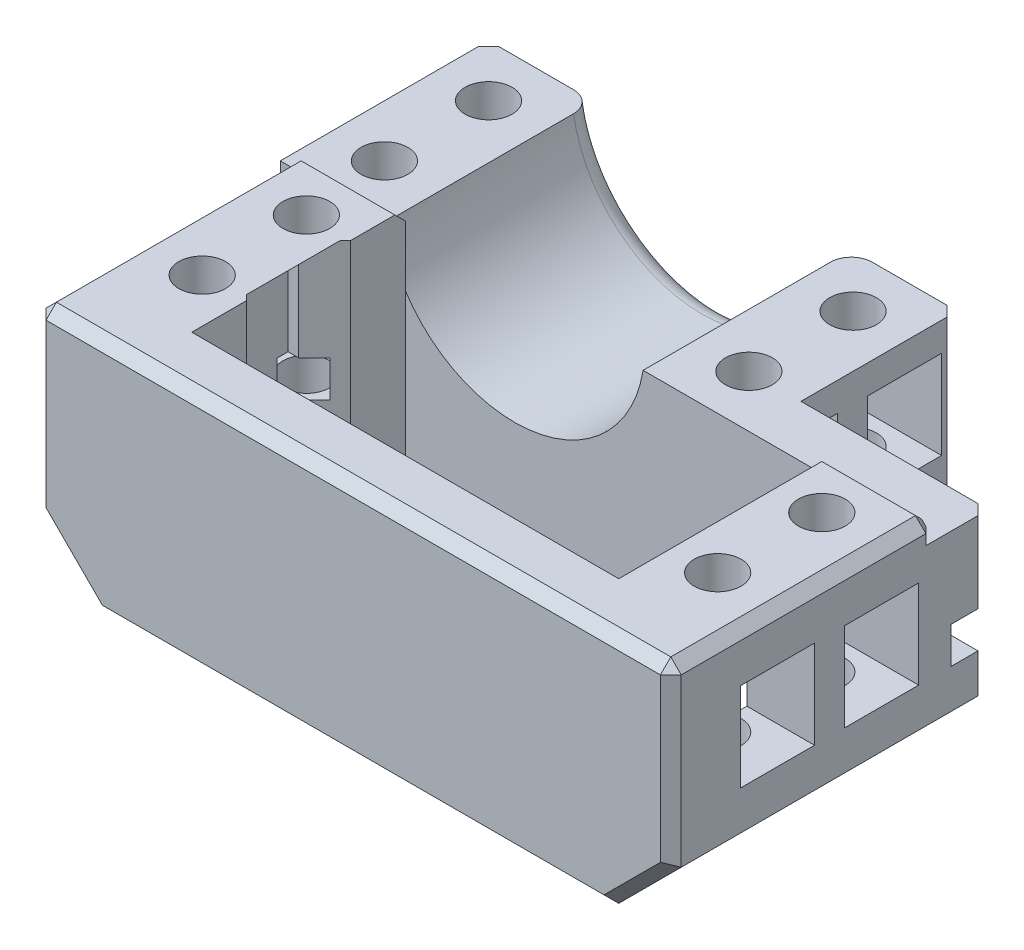
from build123d import *

# Parameters (mm, degrees)
SKETCH1_W           = 41
SKETCH1_H           = 20.5
BOSS_EXTRUDE1_DEPTH = 23
SKETCH2_R           = 12.5
CUT_EXTRUDE1_DEPTH  = 20
SKETCH3_W           = 20
SKETCH3_H           = 23
BOSS_EXTRUDE2_DEPTH = 2
CUT_EXTRUDE2_REACH  = 52.003
SKETCH4_R           = 2.25
CUT_EXTRUDE3_REACH  = 52.003
SKETCH5_R           = 2.25
CUT_EXTRUDE4_DEPTH  = 15
CUT_EXTRUDE5_START  = -9
SKETCH7_W           = 7.1
SKETCH7_H           = 3.5
CUT_EXTRUDE5_DEPTH  = 68.898747864
FILLET1_R           = 2
SKETCH8_W           = 7.1
SKETCH8_H           = 3.5
CUT_EXTRUDE6_DEPTH  = 9
CHAMFER1_SIZE       = 5
CHAMFER3_SIZE       = 5
CHAMFER4_SIZE       = 1
CHAMFER5_SIZE       = 6
CHAMFER6_SIZE       = 1
CHAMFER7_SIZE       = 1
CUT_EXTRUDE7_START  = -10
SKETCH9_W           = 63
SKETCH9_H           = 20
CUT_EXTRUDE7_DEPTH  = 2
CHAMFER8_SIZE       = 1
CUT_EXTRUDE8_REACH  = 69.32
CUT_EXTRUDE8_START  = -12
SKETCH10_W          = 3.5
SKETCH10_H          = 5
CHAMFER9_SIZE       = 2.5


with BuildPart() as part:
    # Sketch1 → Boss-Extrude1 (new body)
    with BuildSketch(Plane(origin=(0, 0, 0), x_dir=(1, 0, 0), z_dir=(0, 1, 0))):
        Polygon((0, -15.25), (-30.5, -15.25), (-30.5, 30.25), (30.5, 30.25), (30.5, -15.25), align=None)
        Rectangle(SKETCH1_W, SKETCH1_H, mode=Mode.SUBTRACT)
    extrude(amount=BOSS_EXTRUDE1_DEPTH)

    # Sketch2 → Cut-Extrude1 (cut)
    with BuildSketch(Plane(origin=(0, 0, -30.25), x_dir=(-1, 0, 0), z_dir=(0, 0, -1))):
        with Locations((10, 23)):
            Circle(SKETCH2_R)
    extrude(amount=-CUT_EXTRUDE1_DEPTH, mode=Mode.SUBTRACT)

    # Sketch3 → Boss-Extrude2 (add)
    with BuildSketch(Plane.ZY.offset(30.5)):
        with Locations((-20.25, 11.5)):
            Rectangle(SKETCH3_W, SKETCH3_H)
    extrude(amount=BOSS_EXTRUDE2_DEPTH)

    # Sketch4 → Cut-Extrude2 (cut, up to next)
    with BuildSketch(Plane(origin=(0, 23, 0), x_dir=(1, 0, 0), z_dir=(0, 1, 0)), mode=Mode.PRIVATE) as cut_extrude2_sk1:
        with Locations(Location((-27.5, 25.25, 0), (0, 0, 270))):
            Circle(SKETCH4_R)
    cut_extrude2_tool1 = extrude(cut_extrude2_sk1.sketch, amount=-CUT_EXTRUDE2_REACH, mode=Mode.PRIVATE) & part.part
    # Sketch4 → Cut-Extrude2 (cut, up to next)
    with BuildSketch(Plane(origin=(0, 23, 0), x_dir=(1, 0, 0), z_dir=(0, 1, 0)), mode=Mode.PRIVATE) as cut_extrude2_sk2:
        with Locations(Location((-27.5, 15.25, 0), (0, 0, 270))):
            Circle(SKETCH4_R)
    cut_extrude2_tool2 = extrude(cut_extrude2_sk2.sketch, amount=-CUT_EXTRUDE2_REACH, mode=Mode.PRIVATE) & part.part
    # Sketch4 → Cut-Extrude2 (cut, up to next)
    with BuildSketch(Plane(origin=(0, 23, 0), x_dir=(1, 0, 0), z_dir=(0, 1, 0)), mode=Mode.PRIVATE) as cut_extrude2_sk3:
        with Locations(Location((7.5, 15.25, 0), (0, 0, 270))):
            Circle(SKETCH4_R)
    cut_extrude2_tool3 = extrude(cut_extrude2_sk3.sketch, amount=-CUT_EXTRUDE2_REACH, mode=Mode.PRIVATE) & part.part
    # Sketch4 → Cut-Extrude2 (cut, up to next)
    with BuildSketch(Plane(origin=(0, 23, 0), x_dir=(1, 0, 0), z_dir=(0, 1, 0)), mode=Mode.PRIVATE) as cut_extrude2_sk4:
        with Locations(Location((7.5, 25.25, 0), (0, 0, 270))):
            Circle(SKETCH4_R)
    cut_extrude2_tool4 = extrude(cut_extrude2_sk4.sketch, amount=-CUT_EXTRUDE2_REACH, mode=Mode.PRIVATE) & part.part
    add(cut_extrude2_tool1.solids().sort_by_distance((-27.5, 23, -25.25))[0], mode=Mode.SUBTRACT)
    add(cut_extrude2_tool2.solids().sort_by_distance((-27.5, 23, -15.25))[0], mode=Mode.SUBTRACT)
    add(cut_extrude2_tool3.solids().sort_by_distance((7.5, 23, -15.25))[0], mode=Mode.SUBTRACT)
    add(cut_extrude2_tool4.solids().sort_by_distance((7.5, 23, -25.25))[0], mode=Mode.SUBTRACT)

    # Sketch5 → Cut-Extrude3 (cut, up to next)
    with BuildSketch(Plane(origin=(0, 23, 0), x_dir=(1, 0, 0), z_dir=(0, 1, 0)), mode=Mode.PRIVATE) as cut_extrude3_sk1:
        with Locations(Location((-24.75, 5, 0), (0, 0, 270))):
            Circle(SKETCH5_R)
    cut_extrude3_tool1 = extrude(cut_extrude3_sk1.sketch, amount=-CUT_EXTRUDE3_REACH, mode=Mode.PRIVATE) & part.part
    # Sketch5 → Cut-Extrude3 (cut, up to next)
    with BuildSketch(Plane(origin=(0, 23, 0), x_dir=(1, 0, 0), z_dir=(0, 1, 0)), mode=Mode.PRIVATE) as cut_extrude3_sk2:
        with Locations(Location((-24.75, -5, 0), (0, 0, 270))):
            Circle(SKETCH5_R)
    cut_extrude3_tool2 = extrude(cut_extrude3_sk2.sketch, amount=-CUT_EXTRUDE3_REACH, mode=Mode.PRIVATE) & part.part
    cut_extrude3_1 = cut_extrude3_tool1.solids().sort_by_distance((-24.75, 23, -5))[0]
    add(cut_extrude3_1, mode=Mode.SUBTRACT)
    cut_extrude3_2 = cut_extrude3_tool2.solids().sort_by_distance((-24.75, 23, 5))[0]
    add(cut_extrude3_2, mode=Mode.SUBTRACT)
    cut_extrude3 = cut_extrude3_1 + cut_extrude3_2  # Cut-Extrude3 as one shape, for the pattern or mirror that repeats it

    # Mirror1: Cut-Extrude3 across plane
    add(cut_extrude3.mirror(Plane(origin=(0, 0, 0), x_dir=(0, 0, 1), z_dir=(1, 0, 0))), mode=Mode.SUBTRACT)

    # Sketch6 → Cut-Extrude4 (cut)
    with BuildSketch(Plane(origin=(0, 0, -30.25), x_dir=(-1, 0, 0), z_dir=(0, 0, -1))):
        Polygon((-12.5, 23), (-12.5, 19), (-12.5, 4), (-12.5, 0), (-30.5, 0), (-30.5, 4), (-30.5, 19), (-30.5, 23), align=None)
    extrude(amount=-CUT_EXTRUDE4_DEPTH, mode=Mode.SUBTRACT)

    # Sketch7 → Cut-Extrude5 (cut)
    with BuildSketch(Plane(origin=(12.5, 0, 0), x_dir=(0, 0, -1), z_dir=(1, 0, 0)).offset(CUT_EXTRUDE5_START)):
        with Locations((25.2, 11.5)):
            Rectangle(SKETCH7_W, SKETCH7_H)
        with Locations((15.2, 11.5)):
            Rectangle(SKETCH7_W, SKETCH7_H)
    cut_extrude5 = extrude(amount=CUT_EXTRUDE5_DEPTH, mode=Mode.SUBTRACT)

    # Mirror2: Cut-Extrude5 across plane
    add(cut_extrude5.mirror(Plane(origin=(-10, 0, 0), x_dir=(0, 0, 1), z_dir=(1, 0, 0))), mode=Mode.SUBTRACT)

    # Fillet1
    fillet1_edges = [part.edges().sort_by_distance(p)[0] for p in [
        (-10, 10.5, -30.25),
    ]]
    fillet(fillet1_edges, radius=FILLET1_R)

    # Sketch8 → Cut-Extrude6 (cut)
    with BuildSketch(Plane.ZY.offset(30.5)):
        with Locations((-5, 11.5)):
            Rectangle(SKETCH8_W, SKETCH8_H)
        with Locations((5, 11.5)):
            Rectangle(SKETCH8_W, SKETCH8_H)
    cut_extrude6 = extrude(amount=-CUT_EXTRUDE6_DEPTH, mode=Mode.SUBTRACT)

    # Mirror3: Cut-Extrude6 across plane
    add(cut_extrude6.mirror(Plane(origin=(0, 0, 0), x_dir=(0, 0, 1), z_dir=(1, 0, 0))), mode=Mode.SUBTRACT)

    # Chamfer1
    # the kernel refuses this chamfer: 5 mm, written as the material it takes off along each edge
    with BuildSketch(Plane(origin=(12.5, 13.25, -8.79158506), x_dir=(0.027495876610586317, 0.9996219169112968, 0), z_dir=(0, 0, -1))) as chamfer1_piece_1_section:
        Polygon((CHAMFER1_SIZE * 0.999621916911, -CHAMFER1_SIZE * 0.0274958766106), (-CHAMFER1_SIZE * 0.0274958766106, -CHAMFER1_SIZE * 0.999621916911), (0, 0), align=None)
    chamfer1_piece_1 = extrude(amount=32.81682988, mode=Mode.PRIVATE)
    chamfer1_piece_1 = split(chamfer1_piece_1, bisect_by=Plane(origin=(11.024157606, 15.012078803, -15.25), z_dir=(0, 0, -1)), keep=Keep.TOP, mode=Mode.PRIVATE)
    chamfer1_piece_1 = split(chamfer1_piece_1, bisect_by=Plane(origin=(11.024157606, 15.012078803, -18.75), z_dir=(0, 0, 1)), keep=Keep.TOP, mode=Mode.PRIVATE)
    add(chamfer1_piece_1, mode=Mode.SUBTRACT)
    with BuildSketch(Plane(origin=(12.5, 13.25, -21.65), x_dir=(0.027495876610586317, 0.9996219169112968, 0), z_dir=(0, 0, -1)), Plane(origin=(-32.5, 13.25, -28.75), x_dir=(-0.02749587661058631, 0.9996219169112968, 0), z_dir=(0, 0, 1)), Plane(origin=(-32.5, 13.25, -18.75), x_dir=(-0.027495876610586317, 0.9996219169112968, 0), z_dir=(0, 0, 1)), Plane(origin=(-30.5, 13.25, 1.45), x_dir=(-0.027495876610586317, 0.9996219169112968, 0), z_dir=(0, 0, 1)), Plane(origin=(30.5, 13.25, -1.45), x_dir=(0.027495876610586317, 0.9996219169112968, 0), z_dir=(0, 0, -1))) as chamfer1_piece_2:
        Polygon((CHAMFER1_SIZE * 0.999621916911, -CHAMFER1_SIZE * 0.0274958766106), (-CHAMFER1_SIZE * 0.0274958766106, -CHAMFER1_SIZE * 0.999621916911), (0, 0), align=None)
    extrude(amount=7.1, mode=Mode.SUBTRACT)
    with BuildSketch(Plane(origin=(12.5, 13.25, -15.25), x_dir=(0.02749587661058631, 0.9996219169112968, 0), z_dir=(0, 0, -1))) as chamfer1_piece_3:
        Polygon((CHAMFER1_SIZE * 0.999621916911, -CHAMFER1_SIZE * 0.0274958766106), (-CHAMFER1_SIZE * 0.0274958766106, -CHAMFER1_SIZE * 0.999621916911), (0, 0), align=None)
    extrude(amount=3.5, mode=Mode.SUBTRACT)
    with BuildSketch(Plane(origin=(12.5, 13.25, -2.39158506), x_dir=(0.02749587661058631, 0.9996219169112968, 0), z_dir=(0, 0, -1))) as chamfer1_piece_4_section:
        Polygon((CHAMFER1_SIZE * 0.999621916911, -CHAMFER1_SIZE * 0.0274958766106), (-CHAMFER1_SIZE * 0.0274958766106, -CHAMFER1_SIZE * 0.999621916911), (0, 0), align=None)
    chamfer1_piece_4 = extrude(amount=29.21682988, mode=Mode.PRIVATE)
    chamfer1_piece_4 = split(chamfer1_piece_4, bisect_by=Plane(origin=(11.021218457, 15.010609228, -21.65), z_dir=(0, 0, -1)), keep=Keep.TOP, mode=Mode.PRIVATE)
    chamfer1_piece_4 = split(chamfer1_piece_4, bisect_by=Plane(origin=(11.021218457, 15.010609228, -28.75), z_dir=(0, 0, 1)), keep=Keep.TOP, mode=Mode.PRIVATE)
    add(chamfer1_piece_4, mode=Mode.SUBTRACT)
    with BuildSketch(Plane(origin=(-32.5, 13.25, -41.60841494), x_dir=(-0.027495876610586327, 0.9996219169112968, 0), z_dir=(0, 0, 1))) as chamfer1_piece_5_section:
        Polygon((CHAMFER1_SIZE * 0.999621916911, -CHAMFER1_SIZE * 0.0274958766106), (-CHAMFER1_SIZE * 0.0274958766106, -CHAMFER1_SIZE * 0.999621916911), (0, 0), align=None)
    chamfer1_piece_5 = extrude(amount=32.81682988, mode=Mode.PRIVATE)
    chamfer1_piece_5 = split(chamfer1_piece_5, bisect_by=Plane(origin=(-31.583333333, 15.291666667, -11.65), z_dir=(0, 0, -1)), keep=Keep.TOP, mode=Mode.PRIVATE)
    chamfer1_piece_5 = split(chamfer1_piece_5, bisect_by=Plane(origin=(-31.583333333, 15.291666667, -18.75), z_dir=(0, 0, 1)), keep=Keep.TOP, mode=Mode.PRIVATE)
    add(chamfer1_piece_5, mode=Mode.SUBTRACT)
    with BuildSketch(Plane(origin=(-32.5, 13.25, -31.60841494), x_dir=(-0.027495876610586317, 0.9996219169112968, 0), z_dir=(0, 0, 1))) as chamfer1_piece_6_section:
        Polygon((CHAMFER1_SIZE * 0.999621916911, -CHAMFER1_SIZE * 0.0274958766106), (-CHAMFER1_SIZE * 0.0274958766106, -CHAMFER1_SIZE * 0.999621916911), (0, 0), align=None)
    chamfer1_piece_6 = extrude(amount=32.81682988, mode=Mode.PRIVATE)
    chamfer1_piece_6 = split(chamfer1_piece_6, bisect_by=Plane(origin=(-31.583333333, 15.291666667, -21.65), z_dir=(0, 0, -1)), keep=Keep.TOP, mode=Mode.PRIVATE)
    chamfer1_piece_6 = split(chamfer1_piece_6, bisect_by=Plane(origin=(-31.583333333, 15.291666667, -28.75), z_dir=(0, 0, 1)), keep=Keep.TOP, mode=Mode.PRIVATE)
    add(chamfer1_piece_6, mode=Mode.SUBTRACT)
    with BuildSketch(Plane(origin=(-32.5, 13.25, -31.60841494), x_dir=(-0.027495876610586317, 0.9996219169112968, 0), z_dir=(0, 0, 1))) as chamfer1_piece_7_section:
        Polygon((CHAMFER1_SIZE * 0.999621916911, -CHAMFER1_SIZE * 0.0274958766106), (-CHAMFER1_SIZE * 0.0274958766106, -CHAMFER1_SIZE * 0.999621916911), (0, 0), align=None)
    chamfer1_piece_7 = extrude(amount=32.81682988, mode=Mode.PRIVATE)
    chamfer1_piece_7 = split(chamfer1_piece_7, bisect_by=Plane(origin=(-29.5, 14.25, -1.45), z_dir=(0, 0, -1)), keep=Keep.TOP, mode=Mode.PRIVATE)
    chamfer1_piece_7 = split(chamfer1_piece_7, bisect_by=Plane(origin=(-29.5, 14.25, -8.55), z_dir=(0, 0, 1)), keep=Keep.TOP, mode=Mode.PRIVATE)
    add(chamfer1_piece_7, mode=Mode.SUBTRACT)
    with BuildSketch(Plane(origin=(-30.5, 13.25, -11.40841494), x_dir=(-0.027495876610586317, 0.9996219169112968, 0), z_dir=(0, 0, 1))) as chamfer1_piece_8_section:
        Polygon((CHAMFER1_SIZE * 0.999621916911, -CHAMFER1_SIZE * 0.0274958766106), (-CHAMFER1_SIZE * 0.0274958766106, -CHAMFER1_SIZE * 0.999621916911), (0, 0), align=None)
    chamfer1_piece_8 = extrude(amount=32.81682988, mode=Mode.PRIVATE)
    chamfer1_piece_8 = split(chamfer1_piece_8, bisect_by=Plane(origin=(-28.915946442, 14.957973221, -1.45), z_dir=(0, 0, -1)), keep=Keep.TOP, mode=Mode.PRIVATE)
    chamfer1_piece_8 = split(chamfer1_piece_8, bisect_by=Plane(origin=(-28.915946442, 14.957973221, -8.55), z_dir=(0, 0, 1)), keep=Keep.TOP, mode=Mode.PRIVATE)
    add(chamfer1_piece_8, mode=Mode.SUBTRACT)
    with BuildSketch(Plane(origin=(-30.5, 13.25, 11.40841494), x_dir=(-0.027495876610586327, 0.9996219169112968, 0), z_dir=(0, 0, -1))) as chamfer1_piece_9_section:
        Polygon((CHAMFER1_SIZE * 0.999621916911, CHAMFER1_SIZE * 0.0274958766106), (-CHAMFER1_SIZE * 0.0274958766106, CHAMFER1_SIZE * 0.999621916911), (0, 0), align=None)
    chamfer1_piece_9 = extrude(amount=32.81682988, mode=Mode.PRIVATE)
    chamfer1_piece_9 = split(chamfer1_piece_9, bisect_by=Plane(origin=(-28.915946442, 14.957973221, 8.55), z_dir=(0, 0, -1)), keep=Keep.TOP, mode=Mode.PRIVATE)
    chamfer1_piece_9 = split(chamfer1_piece_9, bisect_by=Plane(origin=(-28.915946442, 14.957973221, 1.45), z_dir=(0, 0, 1)), keep=Keep.TOP, mode=Mode.PRIVATE)
    add(chamfer1_piece_9, mode=Mode.SUBTRACT)
    with BuildSketch(Plane(origin=(-30.5, 13.25, -1.45), x_dir=(-0.027495876610586317, 0.9996219169112968, 0), z_dir=(0, 0, -1)), Plane(origin=(30.5, 13.25, 1.45), x_dir=(0.027495876610586317, 0.9996219169112968, 0), z_dir=(0, 0, 1))) as chamfer1_piece_10:
        Polygon((CHAMFER1_SIZE * 0.999621916911, CHAMFER1_SIZE * 0.0274958766106), (-CHAMFER1_SIZE * 0.0274958766106, CHAMFER1_SIZE * 0.999621916911), (0, 0), align=None)
    extrude(amount=7.1, mode=Mode.SUBTRACT)
    with BuildSketch(Plane(origin=(30.5, 13.25, -11.40841494), x_dir=(0.027495876610586317, 0.9996219169112968, 0), z_dir=(0, 0, 1))) as chamfer1_piece_11_section:
        Polygon((CHAMFER1_SIZE * 0.999621916911, CHAMFER1_SIZE * 0.0274958766106), (-CHAMFER1_SIZE * 0.0274958766106, CHAMFER1_SIZE * 0.999621916911), (0, 0), align=None)
    chamfer1_piece_11 = extrude(amount=32.81682988, mode=Mode.PRIVATE)
    chamfer1_piece_11 = split(chamfer1_piece_11, bisect_by=Plane(origin=(28.915946442, 14.957973221, -8.55), z_dir=(0, 0, 1)), keep=Keep.TOP, mode=Mode.PRIVATE)
    chamfer1_piece_11 = split(chamfer1_piece_11, bisect_by=Plane(origin=(28.915946442, 14.957973221, -1.45), z_dir=(0, 0, -1)), keep=Keep.TOP, mode=Mode.PRIVATE)
    add(chamfer1_piece_11, mode=Mode.SUBTRACT)
    with BuildSketch(Plane(origin=(30.5, 13.25, 11.40841494), x_dir=(0.027495876610586327, 0.9996219169112968, 0), z_dir=(0, 0, -1))) as chamfer1_piece_12_section:
        Polygon((CHAMFER1_SIZE * 0.999621916911, -CHAMFER1_SIZE * 0.0274958766106), (-CHAMFER1_SIZE * 0.0274958766106, -CHAMFER1_SIZE * 0.999621916911), (0, 0), align=None)
    chamfer1_piece_12 = extrude(amount=32.81682988, mode=Mode.PRIVATE)
    chamfer1_piece_12 = split(chamfer1_piece_12, bisect_by=Plane(origin=(28.915946442, 14.957973221, 1.45), z_dir=(0, 0, 1)), keep=Keep.TOP, mode=Mode.PRIVATE)
    chamfer1_piece_12 = split(chamfer1_piece_12, bisect_by=Plane(origin=(28.915946442, 14.957973221, 8.55), z_dir=(0, 0, -1)), keep=Keep.TOP, mode=Mode.PRIVATE)
    add(chamfer1_piece_12, mode=Mode.SUBTRACT)

    # Chamfer2
    # the kernel refuses this chamfer: 8 mm, written as the material it takes off along each edge
    with BuildSketch(Plane(origin=(-32.5, 0, 39.126313369), x_dir=(0.9996219169112968, -0.027495876610586365, 0), z_dir=(0, 0, -1))) as chamfer2_piece_1:
        with BuildLine():
            Line((8.229385561, 0), (-0.452377239, -8.216942348))
            Line((-0.452377239, -8.216942348), (-0.612316746, -8.212543008))
            ThreePointArc((-0.612316746, -8.212543008), (-0.273033816, -4.107182637), (-0.159939507, 0.00439934))
            Line((-0.159939507, 0.00439934), (0.00439934, 0.159939507))
            ThreePointArc((0.00439934, 0.159939507), (4.115981318, 0.046845197), (8.233784902, 0.159939507))
            Line((8.233784902, 0.159939507), (8.229385561, 0))
        make_face()
    extrude(amount=118.752626738, mode=Mode.SUBTRACT)

    # Chamfer3
    # the kernel refuses this chamfer: 5 mm, written as the material it takes off along each edge
    with BuildSketch(Plane(origin=(12.5, 0, -43.10841494), x_dir=(0.027495876610586317, 0.9996219169112968, 0), z_dir=(0, 0, 1))) as chamfer3_piece_1:
        Polygon((CHAMFER3_SIZE * 0.999621916911, CHAMFER3_SIZE * 0.0274958766106), (-CHAMFER3_SIZE * 0.0274958766106, CHAMFER3_SIZE * 0.999621916911), (0, 0), align=None)
    extrude(amount=27.85841494, mode=Mode.SUBTRACT)

    # Chamfer4
    chamfer4_edges = [part.edges().sort_by_distance(p)[0] for p in [
        (-28.5, 4, -30.25),
        (12.5, 14, -30.25),
        (-8.5, 0, -30.25),
        (10, 2.5, -30.25),
        (-32.5, 15.5, -30.25),
    ]]
    chamfer(chamfer4_edges, length=CHAMFER4_SIZE)

    # Chamfer5
    # the kernel refuses this chamfer: 6 mm, written as the material it takes off along each edge
    with BuildSketch(Plane(origin=(30.5, 0, -30.680097928), x_dir=(0.027495876610586202, 0.9996219169112968, 0), z_dir=(0, 0, 1))) as chamfer5_piece_1:
        Polygon((CHAMFER5_SIZE * 0.999621916911, CHAMFER5_SIZE * 0.0274958766106), (-CHAMFER5_SIZE * 0.0274958766106, CHAMFER5_SIZE * 0.999621916911), (0, 0), align=None)
    extrude(amount=61.360195856, mode=Mode.SUBTRACT)

    # Chamfer6
    chamfer6_edges = [part.edges().sort_by_distance(p)[0] for p in [
        (21.5, 23, -15.25),
        (30.5, 18.125, -15.25),
        (30.5, 7.875, -15.25),
        (21.5, 9.75, -15.25),
        (20.125, 13.25, -15.25),
        (0, 0, 15.25),
        (-27.5, 3, 15.25),
        (27.5, 3, 15.25),
        (-30.5, 23, 2.5),
        (0, 23, 15.25),
        (30.5, 23, 0),
        (-30.5, 14.5, 15.25),
        (30.5, 14.5, 15.25),
    ]]
    chamfer(chamfer6_edges, length=CHAMFER6_SIZE)

    # Chamfer7
    chamfer7_edges = [part.edges().sort_by_distance(p)[0] for p in [
        (17.125, 0, -15.25),
        (27, 2.5, -15.25),
    ]]
    chamfer(chamfer7_edges, length=CHAMFER7_SIZE)

    # Sketch9 → Cut-Extrude7 (cut)
    with BuildSketch(Plane(origin=(0, 33, 0), x_dir=(1, 0, 0), z_dir=(0, 1, 0)).offset(CUT_EXTRUDE7_START)):
        with Locations((-1, 20.25)):
            Rectangle(SKETCH9_W, SKETCH9_H)
    extrude(amount=-CUT_EXTRUDE7_DEPTH, mode=Mode.SUBTRACT)

    # Chamfer8
    chamfer8_edges = [part.edges().sort_by_distance(p)[0] for p in [
        (-25, 23, -10.25),
        (-30, 22.5, -10.25),
        (25, 23, -10.25),
        (30.5, 21.5, -10.25),
        (30, 22.5, -10.25),
        (-30.5, 21.5, -10.25),
    ]]
    chamfer(chamfer8_edges, length=CHAMFER8_SIZE)

    # Sketch10 → Cut-Extrude8 (cut, up to next)
    with BuildSketch(Plane(origin=(0, 33, 0), x_dir=(1, 0, 0), z_dir=(0, 1, 0)).offset(CUT_EXTRUDE8_START), mode=Mode.PRIVATE) as cut_extrude8_sk1:
        with Locations((22.25, 0)):
            Rectangle(SKETCH10_W, SKETCH10_H)
    cut_extrude8_tool1 = extrude(cut_extrude8_sk1.sketch, amount=-CUT_EXTRUDE8_REACH, mode=Mode.PRIVATE) & part.part
    cut_extrude8 = cut_extrude8_tool1.solids().sort_by_distance((22.25, 21, 0))[0]
    add(cut_extrude8, mode=Mode.SUBTRACT)

    # Chamfer9
    # the kernel refuses this chamfer: 2.5 mm, written as the material it takes off along each edge
    with BuildSketch(Plane(origin=(20.5, 21, -2.5), x_dir=(-0.027495876610586317, 0, -0.9996219169112968), z_dir=(0, -1, 0))) as chamfer9_piece_1:
        Polygon((CHAMFER9_SIZE * 0.999621916911, CHAMFER9_SIZE * 0.0274958766106), (-CHAMFER9_SIZE * 0.0274958766106, CHAMFER9_SIZE * 0.999621916911), (0, 0), align=None)
    extrude(amount=27.42920747, mode=Mode.SUBTRACT)
    with BuildSketch(Plane(origin=(20.5, 21, 2.5), x_dir=(-0.027495876610586317, 0, 0.9996219169112968), z_dir=(0, -1, 0))) as chamfer9_piece_2:
        Polygon((CHAMFER9_SIZE * 0.999621916911, -CHAMFER9_SIZE * 0.0274958766106), (-CHAMFER9_SIZE * 0.0274958766106, -CHAMFER9_SIZE * 0.999621916911), (0, 0), align=None)
    extrude(amount=27.42920747, mode=Mode.SUBTRACT)

    # Mirror4: Cut-Extrude8 across plane
    add(cut_extrude8.mirror(Plane(origin=(0, 0, 0), x_dir=(0, 0, 1), z_dir=(1, 0, 0))), mode=Mode.SUBTRACT)

    # Chamfer10
    # the kernel refuses this chamfer: 2.5 mm, written as the material it takes off along each edge
    with BuildSketch(Plane(origin=(-20.5, 21, 2.5), x_dir=(0.027495876610586317, 0, 0.9996219169112968), z_dir=(0, -1, 0))) as chamfer10_piece_1:
        with BuildLine():
            Line((2.571682988, 0), (-0.141367887, 2.567794484))
            Line((-0.141367887, 2.567794484), (-0.191348983, 2.56641969))
            ThreePointArc((-0.191348983, 2.56641969), (-0.085323068, 1.283494574), (-0.049981096, -0.001374794))
            Line((-0.049981096, -0.001374794), (0.001374794, -0.049981096))
            ThreePointArc((0.001374794, -0.049981096), (1.286244162, -0.014639124), (2.573057782, -0.049981096))
            Line((2.573057782, -0.049981096), (2.571682988, 0))
        make_face()
    extrude(amount=21, mode=Mode.SUBTRACT)
    with BuildSketch(Plane(origin=(-20.5, 21, 2.5), x_dir=(0.027495876610586317, 0.9996219169112968, 0), z_dir=(0, 0, -1))) as chamfer10_piece_2:
        with BuildLine():
            Line((2.571682988, 0), (-0.141367887, -2.567794484))
            Line((-0.141367887, -2.567794484), (-0.191348983, -2.56641969))
            ThreePointArc((-0.191348983, -2.56641969), (-0.085323068, -1.283494574), (-0.049981096, 0.001374794))
            Line((-0.049981096, 0.001374794), (0.001374794, 0.049981096))
            ThreePointArc((0.001374794, 0.049981096), (1.286244162, 0.014639124), (2.573057782, 0.049981096))
            Line((2.573057782, 0.049981096), (2.571682988, 0))
        make_face()
    extrude(amount=5, mode=Mode.SUBTRACT)
    with BuildSketch(Plane(origin=(-20.5, 21, -2.5), x_dir=(0.027495876610586317, 0, -0.9996219169112968), z_dir=(0, -1, 0))) as chamfer10_piece_3:
        with BuildLine():
            Line((2.571682988, 0), (-0.141367887, -2.567794484))
            Line((-0.141367887, -2.567794484), (-0.191348983, -2.56641969))
            ThreePointArc((-0.191348983, -2.56641969), (-0.085323068, -1.283494574), (-0.049981096, 0.001374794))
            Line((-0.049981096, 0.001374794), (0.001374794, 0.049981096))
            ThreePointArc((0.001374794, 0.049981096), (1.286244162, 0.014639124), (2.573057782, 0.049981096))
            Line((2.573057782, 0.049981096), (2.571682988, 0))
        make_face()
    extrude(amount=21, mode=Mode.SUBTRACT)
    with BuildSketch(Plane(origin=(-20.5, 27.42920747, 2.5), x_dir=(0.027495876610586317, 0, 0.9996219169112968), z_dir=(0, -1, 0))) as chamfer10_piece_4a_section:
        with BuildLine():
            Line((2.571682988, 0), (-0.141367887, 2.567794484))
            Line((-0.141367887, 2.567794484), (-0.191348983, 2.56641969))
            ThreePointArc((-0.191348983, 2.56641969), (-0.085323068, 1.283494574), (-0.049981096, -0.001374794))
            Line((-0.049981096, -0.001374794), (0.001374794, -0.049981096))
            ThreePointArc((0.001374794, -0.049981096), (1.286244162, -0.014639124), (2.573057782, -0.049981096))
            Line((2.573057782, -0.049981096), (2.571682988, 0))
        make_face()
    chamfer10_piece_4a = extrude(amount=27.42920747, mode=Mode.PRIVATE)
    chamfer10_piece_4a = split(chamfer10_piece_4a, bisect_by=Plane(origin=(-21.324484067, 21, 3.324484067), z_dir=(0, 1, 0)), keep=Keep.TOP, mode=Mode.PRIVATE)
    with BuildSketch(Plane(origin=(-20.5, 21, 8.92920747), x_dir=(0.027495876610586317, 0.9996219169112968, 0), z_dir=(0, 0, -1))) as chamfer10_piece_4b_section:
        with BuildLine():
            Line((2.571682988, 0), (-0.141367887, -2.567794484))
            Line((-0.141367887, -2.567794484), (-0.191348983, -2.56641969))
            ThreePointArc((-0.191348983, -2.56641969), (-0.085323068, -1.283494574), (-0.049981096, 0.001374794))
            Line((-0.049981096, 0.001374794), (0.001374794, 0.049981096))
            ThreePointArc((0.001374794, 0.049981096), (1.286244162, 0.014639124), (2.573057782, 0.049981096))
            Line((2.573057782, 0.049981096), (2.571682988, 0))
        make_face()
    chamfer10_piece_4b = extrude(amount=11.42920747, mode=Mode.PRIVATE)
    chamfer10_piece_4b = split(chamfer10_piece_4b, bisect_by=Plane(origin=(-21.324484067, 21.824484067, 2.5), z_dir=(0, 0, 1)), keep=Keep.TOP, mode=Mode.PRIVATE)
    chamfer10_piece_4 = chamfer10_piece_4a & chamfer10_piece_4b
    add(chamfer10_piece_4, mode=Mode.SUBTRACT)
    with BuildSketch(Plane(origin=(-20.5, 21, 2.5), x_dir=(0.027495876610586317, 0.9996219169112968, 0), z_dir=(0, 0, -1))) as chamfer10_piece_5a_section:
        with BuildLine():
            Line((2.571682988, 0), (-0.141367887, -2.567794484))
            Line((-0.141367887, -2.567794484), (-0.191348983, -2.56641969))
            ThreePointArc((-0.191348983, -2.56641969), (-0.085323068, -1.283494574), (-0.049981096, 0.001374794))
            Line((-0.049981096, 0.001374794), (0.001374794, 0.049981096))
            ThreePointArc((0.001374794, 0.049981096), (1.286244162, 0.014639124), (2.573057782, 0.049981096))
            Line((2.573057782, 0.049981096), (2.571682988, 0))
        make_face()
    chamfer10_piece_5a = extrude(amount=11.42920747, mode=Mode.PRIVATE)
    chamfer10_piece_5a = split(chamfer10_piece_5a, bisect_by=Plane(origin=(-21.324484067, 21.824484067, -2.5), z_dir=(0, 0, -1)), keep=Keep.TOP, mode=Mode.PRIVATE)
    with BuildSketch(Plane(origin=(-20.5, 27.42920747, -2.5), x_dir=(0.027495876610586317, 0, -0.9996219169112968), z_dir=(0, -1, 0))) as chamfer10_piece_5b_section:
        with BuildLine():
            Line((2.571682988, 0), (-0.141367887, -2.567794484))
            Line((-0.141367887, -2.567794484), (-0.191348983, -2.56641969))
            ThreePointArc((-0.191348983, -2.56641969), (-0.085323068, -1.283494574), (-0.049981096, 0.001374794))
            Line((-0.049981096, 0.001374794), (0.001374794, 0.049981096))
            ThreePointArc((0.001374794, 0.049981096), (1.286244162, 0.014639124), (2.573057782, 0.049981096))
            Line((2.573057782, 0.049981096), (2.571682988, 0))
        make_face()
    chamfer10_piece_5b = extrude(amount=27.42920747, mode=Mode.PRIVATE)
    chamfer10_piece_5b = split(chamfer10_piece_5b, bisect_by=Plane(origin=(-21.324484067, 21, -3.324484067), z_dir=(0, 1, 0)), keep=Keep.TOP, mode=Mode.PRIVATE)
    chamfer10_piece_5 = chamfer10_piece_5a & chamfer10_piece_5b
    add(chamfer10_piece_5, mode=Mode.SUBTRACT)


solid = part.part
